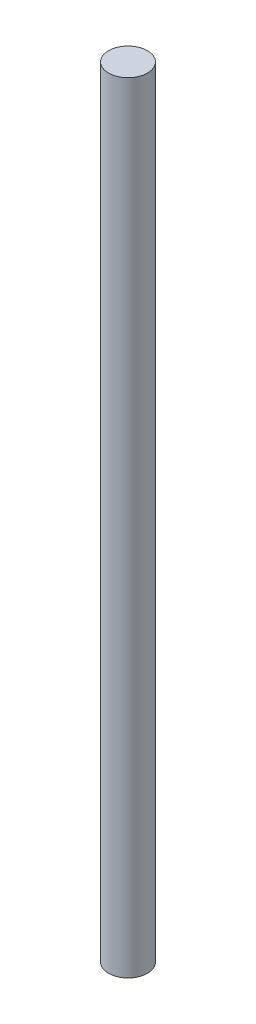
from build123d import *

# Parameters (mm, degrees)
SKETCH1_R           = 9.4996
BOSS_EXTRUDE1_DEPTH = 190.5


with BuildPart() as part:
    # Sketch1 → Boss-Extrude1 (new, symmetric)
    with BuildSketch(Plane(origin=(0, 0, 0), x_dir=(1, 0, 0), z_dir=(0, 1, 0))):
        Circle(SKETCH1_R)
    extrude(amount=BOSS_EXTRUDE1_DEPTH, both=True)


solid = part.part
